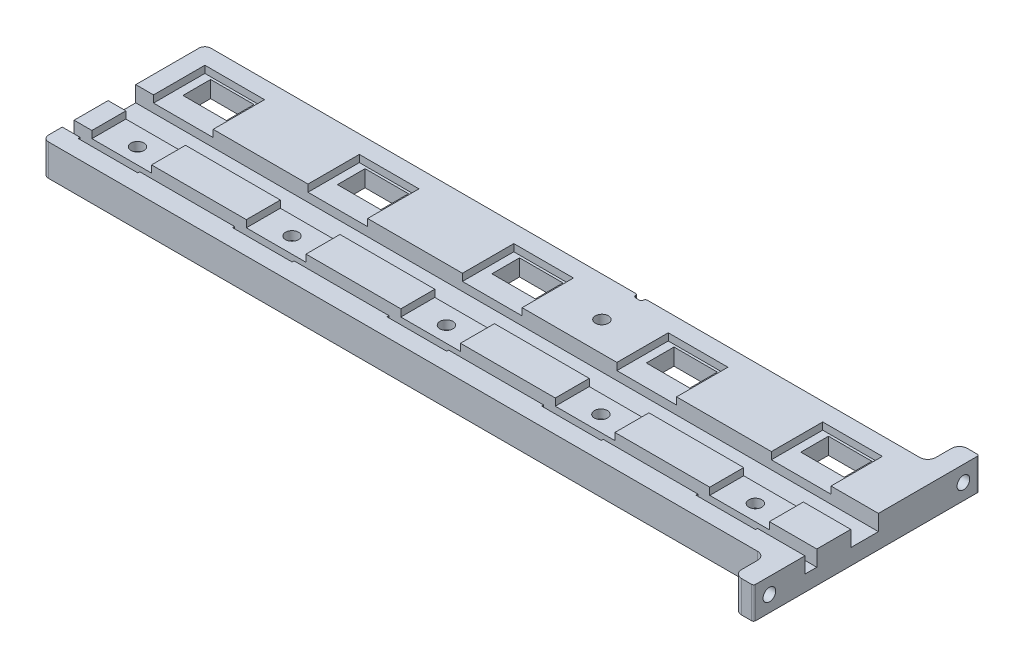
from build123d import *

# Parameters (mm, degrees)
SKETCH1_W           = 376
SKETCH1_H           = 41.1
SKETCH1_R           = 1.65
SKETCH1_W_2         = 11
SKETCH1_H_2         = 7
BOSS_EXTRUDE1_DEPTH = 8
SKETCH2_W           = 376
SKETCH2_H           = 3
SKETCH2_H_2         = 7
CUT_EXTRUDE1_DEPTH  = 4
CUT_EXTRUDE2_START  = -1.8
SKETCH3_W           = 15.1
SKETCH3_H           = 13
SKETCH3_W_2         = 11
SKETCH3_H_2         = 7
SKETCH3_H_3         = 8.6
SKETCH3_R           = 1.65
SKETCH3_H_4         = 0.5
CUT_EXTRUDE2_DEPTH  = 1.8
SKETCH5_R           = 1.65
CUT_EXTRUDE3_DEPTH  = 46.5
CHAMFER1_SIZE       = 2
CUT_EXTRUDE4_DEPTH  = 4
FILLET1_R           = 1.5
SKETCH7_W           = 188
SKETCH7_H           = 41.1
CUT_EXTRUDE5_DEPTH  = 70
SKETCH8_W           = 5
SKETCH8_H           = 8
BOSS_EXTRUDE2_DEPTH = 8
SKETCH9_R           = 1.6
CUT_EXTRUDE6_DEPTH  = 8
FILLET2_R           = 0.5
FILLET3_R           = 2
SKETCH11_W          = 2
SKETCH11_H          = 2
CUT_EXTRUDE7_DEPTH  = 13
FILLET4_R           = 0.5


with BuildPart() as part:
    # Sketch1 → Boss-Extrude1 (new body)
    with BuildSketch(Plane(origin=(0, 0, 0), x_dir=(1, 0, 0), z_dir=(0, 1, 0))):
        Rectangle(SKETCH1_W, SKETCH1_H)
        with Locations(Location((19.55, -8.55, 0), (0, 0, 270))):
            Circle(SKETCH1_R, mode=Mode.SUBTRACT)
        with Locations(Location((58.65, -8.55, 0), (0, 0, 270))):
            Circle(SKETCH1_R, mode=Mode.SUBTRACT)
        with Locations(Location((-19.55, -8.55, 0), (0, 0, 270))):
            Circle(SKETCH1_R, mode=Mode.SUBTRACT)
        with Locations(Location((97.75, -8.55, 0), (0, 0, 270))):
            Circle(SKETCH1_R, mode=Mode.SUBTRACT)
        with Locations(Location((-58.65, -8.55, 0), (0, 0, 270))):
            Circle(SKETCH1_R, mode=Mode.SUBTRACT)
        with Locations(Location((-97.75, -8.55, 0), (0, 0, 270))):
            Circle(SKETCH1_R, mode=Mode.SUBTRACT)
        with Locations(Location((-136.85, -8.55, 0), (0, 0, 270))):
            Circle(SKETCH1_R, mode=Mode.SUBTRACT)
        with Locations(Location((-175.95, -8.55, 0), (0, 0, 270))):
            Circle(SKETCH1_R, mode=Mode.SUBTRACT)
        with Locations(Location((136.85, -8.55, 0), (0, 0, 270))):
            Circle(SKETCH1_R, mode=Mode.SUBTRACT)
        with Locations(Location((175.95, -8.55, 0), (0, 0, 270))):
            Circle(SKETCH1_R, mode=Mode.SUBTRACT)
        with Locations((19.55, 11.95)):
            Rectangle(SKETCH1_W_2, SKETCH1_H_2, mode=Mode.SUBTRACT)
        with Locations((58.65, 11.95)):
            Rectangle(SKETCH1_W_2, SKETCH1_H_2, mode=Mode.SUBTRACT)
        with Locations((-19.55, 11.95)):
            Rectangle(SKETCH1_W_2, SKETCH1_H_2, mode=Mode.SUBTRACT)
        with Locations((97.75, 11.95)):
            Rectangle(SKETCH1_W_2, SKETCH1_H_2, mode=Mode.SUBTRACT)
        with Locations((-58.65, 11.95)):
            Rectangle(SKETCH1_W_2, SKETCH1_H_2, mode=Mode.SUBTRACT)
        with Locations((-97.75, 11.95)):
            Rectangle(SKETCH1_W_2, SKETCH1_H_2, mode=Mode.SUBTRACT)
        with Locations((-136.85, 11.95)):
            Rectangle(SKETCH1_W_2, SKETCH1_H_2, mode=Mode.SUBTRACT)
        with Locations((-175.95, 11.95)):
            Rectangle(SKETCH1_W_2, SKETCH1_H_2, mode=Mode.SUBTRACT)
        with Locations((136.85, 11.95)):
            Rectangle(SKETCH1_W_2, SKETCH1_H_2, mode=Mode.SUBTRACT)
        with Locations((175.95, 11.95)):
            Rectangle(SKETCH1_W_2, SKETCH1_H_2, mode=Mode.SUBTRACT)
    extrude(amount=BOSS_EXTRUDE1_DEPTH)

    # Sketch2 → Cut-Extrude1 (cut)
    with BuildSketch(Plane(origin=(0, 8, 0), x_dir=(1, 0, 0), z_dir=(0, 1, 0))):
        with Locations((0, -14.05)):
            Rectangle(SKETCH2_W, SKETCH2_H)
        with Locations((0, -0.45)):
            Rectangle(SKETCH2_W, SKETCH2_H_2)
    extrude(amount=-CUT_EXTRUDE1_DEPTH, mode=Mode.SUBTRACT)

    # Sketch3 → Cut-Extrude2 (cut)
    # profile 1 of 30: a face of its own
    with BuildSketch(Plane(origin=(0, 8, 0), x_dir=(1, 0, 0), z_dir=(0, 1, 0)).offset(CUT_EXTRUDE2_START)):
        with Locations((-175.95, 9.55)):
            Rectangle(SKETCH3_W, SKETCH3_H)
        with Locations((-175.95, 11.95)):
            Rectangle(SKETCH3_W_2, SKETCH3_H_2, mode=Mode.SUBTRACT)
    # profile 2 of 30: a face of its own
    with BuildSketch(Plane(origin=(0, 8, 0), x_dir=(1, 0, 0), z_dir=(0, 1, 0)).offset(CUT_EXTRUDE2_START)):
        with Locations((-175.95, -8.25)):
            Rectangle(SKETCH3_W, SKETCH3_H_3)
        with Locations(Location((-175.95, -8.55, 0), (0, 0, 90))):
            Circle(SKETCH3_R, mode=Mode.SUBTRACT)
    # profile 3 of 30: a face of its own
    with BuildSketch(Plane(origin=(0, 8, 0), x_dir=(1, 0, 0), z_dir=(0, 1, 0)).offset(CUT_EXTRUDE2_START)):
        with Locations((-136.85, 9.55)):
            Rectangle(SKETCH3_W, SKETCH3_H)
        with Locations((-136.85, 11.95)):
            Rectangle(SKETCH3_W_2, SKETCH3_H_2, mode=Mode.SUBTRACT)
    # profile 4 of 30: a face of its own
    with BuildSketch(Plane(origin=(0, 8, 0), x_dir=(1, 0, 0), z_dir=(0, 1, 0)).offset(CUT_EXTRUDE2_START)):
        with Locations((-175.95, -15.8)):
            Rectangle(SKETCH3_W, SKETCH3_H_4)
    # profile 5 of 30: a face of its own
    with BuildSketch(Plane(origin=(0, 8, 0), x_dir=(1, 0, 0), z_dir=(0, 1, 0)).offset(CUT_EXTRUDE2_START)):
        with Locations((-136.85, -8.25)):
            Rectangle(SKETCH3_W, SKETCH3_H_3)
        with Locations(Location((-136.85, -8.55, 0), (0, 0, 90))):
            Circle(SKETCH3_R, mode=Mode.SUBTRACT)
    # profile 6 of 30: a face of its own
    with BuildSketch(Plane(origin=(0, 8, 0), x_dir=(1, 0, 0), z_dir=(0, 1, 0)).offset(CUT_EXTRUDE2_START)):
        with Locations((-97.75, 9.55)):
            Rectangle(SKETCH3_W, SKETCH3_H)
        with Locations((-97.75, 11.95)):
            Rectangle(SKETCH3_W_2, SKETCH3_H_2, mode=Mode.SUBTRACT)
    # profile 7 of 30: a face of its own
    with BuildSketch(Plane(origin=(0, 8, 0), x_dir=(1, 0, 0), z_dir=(0, 1, 0)).offset(CUT_EXTRUDE2_START)):
        with Locations((-136.85, -15.8)):
            Rectangle(SKETCH3_W, SKETCH3_H_4)
    # profile 8 of 30: a face of its own
    with BuildSketch(Plane(origin=(0, 8, 0), x_dir=(1, 0, 0), z_dir=(0, 1, 0)).offset(CUT_EXTRUDE2_START)):
        with Locations((-97.75, -8.25)):
            Rectangle(SKETCH3_W, SKETCH3_H_3)
        with Locations(Location((-97.75, -8.55, 0), (0, 0, 90))):
            Circle(SKETCH3_R, mode=Mode.SUBTRACT)
    # profile 9 of 30: a face of its own
    with BuildSketch(Plane(origin=(0, 8, 0), x_dir=(1, 0, 0), z_dir=(0, 1, 0)).offset(CUT_EXTRUDE2_START)):
        with Locations((175.95, 9.55)):
            Rectangle(SKETCH3_W, SKETCH3_H)
        with Locations((175.95, 11.95)):
            Rectangle(SKETCH3_W_2, SKETCH3_H_2, mode=Mode.SUBTRACT)
    # profile 10 of 30: a face of its own
    with BuildSketch(Plane(origin=(0, 8, 0), x_dir=(1, 0, 0), z_dir=(0, 1, 0)).offset(CUT_EXTRUDE2_START)):
        with Locations((-58.65, 9.55)):
            Rectangle(SKETCH3_W, SKETCH3_H)
        with Locations((-58.65, 11.95)):
            Rectangle(SKETCH3_W_2, SKETCH3_H_2, mode=Mode.SUBTRACT)
    # profile 11 of 30: a face of its own
    with BuildSketch(Plane(origin=(0, 8, 0), x_dir=(1, 0, 0), z_dir=(0, 1, 0)).offset(CUT_EXTRUDE2_START)):
        with Locations((175.95, -8.25)):
            Rectangle(SKETCH3_W, SKETCH3_H_3)
        with Locations(Location((175.95, -8.55, 0), (0, 0, 90))):
            Circle(SKETCH3_R, mode=Mode.SUBTRACT)
    # profile 12 of 30: a face of its own
    with BuildSketch(Plane(origin=(0, 8, 0), x_dir=(1, 0, 0), z_dir=(0, 1, 0)).offset(CUT_EXTRUDE2_START)):
        with Locations((-97.75, -15.8)):
            Rectangle(SKETCH3_W, SKETCH3_H_4)
    # profile 13 of 30: a face of its own
    with BuildSketch(Plane(origin=(0, 8, 0), x_dir=(1, 0, 0), z_dir=(0, 1, 0)).offset(CUT_EXTRUDE2_START)):
        with Locations((-58.65, -8.25)):
            Rectangle(SKETCH3_W, SKETCH3_H_3)
        with Locations(Location((-58.65, -8.55, 0), (0, 0, 90))):
            Circle(SKETCH3_R, mode=Mode.SUBTRACT)
    # profile 14 of 30: a face of its own
    with BuildSketch(Plane(origin=(0, 8, 0), x_dir=(1, 0, 0), z_dir=(0, 1, 0)).offset(CUT_EXTRUDE2_START)):
        with Locations((136.85, 9.55)):
            Rectangle(SKETCH3_W, SKETCH3_H)
        with Locations((136.85, 11.95)):
            Rectangle(SKETCH3_W_2, SKETCH3_H_2, mode=Mode.SUBTRACT)
    # profile 15 of 30: a face of its own
    with BuildSketch(Plane(origin=(0, 8, 0), x_dir=(1, 0, 0), z_dir=(0, 1, 0)).offset(CUT_EXTRUDE2_START)):
        with Locations((-19.55, 9.55)):
            Rectangle(SKETCH3_W, SKETCH3_H)
        with Locations((-19.55, 11.95)):
            Rectangle(SKETCH3_W_2, SKETCH3_H_2, mode=Mode.SUBTRACT)
    # profile 16 of 30: a face of its own
    with BuildSketch(Plane(origin=(0, 8, 0), x_dir=(1, 0, 0), z_dir=(0, 1, 0)).offset(CUT_EXTRUDE2_START)):
        with Locations((175.95, -15.8)):
            Rectangle(SKETCH3_W, SKETCH3_H_4)
    # profile 17 of 30: a face of its own
    with BuildSketch(Plane(origin=(0, 8, 0), x_dir=(1, 0, 0), z_dir=(0, 1, 0)).offset(CUT_EXTRUDE2_START)):
        with Locations((136.85, -8.25)):
            Rectangle(SKETCH3_W, SKETCH3_H_3)
        with Locations(Location((136.85, -8.55, 0), (0, 0, 90))):
            Circle(SKETCH3_R, mode=Mode.SUBTRACT)
    # profile 18 of 30: a face of its own
    with BuildSketch(Plane(origin=(0, 8, 0), x_dir=(1, 0, 0), z_dir=(0, 1, 0)).offset(CUT_EXTRUDE2_START)):
        with Locations((-58.65, -15.8)):
            Rectangle(SKETCH3_W, SKETCH3_H_4)
    # profile 19 of 30: a face of its own
    with BuildSketch(Plane(origin=(0, 8, 0), x_dir=(1, 0, 0), z_dir=(0, 1, 0)).offset(CUT_EXTRUDE2_START)):
        with Locations((-19.55, -8.25)):
            Rectangle(SKETCH3_W, SKETCH3_H_3)
        with Locations(Location((-19.55, -8.55, 0), (0, 0, 90))):
            Circle(SKETCH3_R, mode=Mode.SUBTRACT)
    # profile 20 of 30: a face of its own
    with BuildSketch(Plane(origin=(0, 8, 0), x_dir=(1, 0, 0), z_dir=(0, 1, 0)).offset(CUT_EXTRUDE2_START)):
        with Locations((97.75, 9.55)):
            Rectangle(SKETCH3_W, SKETCH3_H)
        with Locations((97.75, 11.95)):
            Rectangle(SKETCH3_W_2, SKETCH3_H_2, mode=Mode.SUBTRACT)
    # profile 21 of 30: a face of its own
    with BuildSketch(Plane(origin=(0, 8, 0), x_dir=(1, 0, 0), z_dir=(0, 1, 0)).offset(CUT_EXTRUDE2_START)):
        with Locations((19.55, 9.55)):
            Rectangle(SKETCH3_W, SKETCH3_H)
        with Locations((19.55, 11.95)):
            Rectangle(SKETCH3_W_2, SKETCH3_H_2, mode=Mode.SUBTRACT)
    # profile 22 of 30: a face of its own
    with BuildSketch(Plane(origin=(0, 8, 0), x_dir=(1, 0, 0), z_dir=(0, 1, 0)).offset(CUT_EXTRUDE2_START)):
        with Locations((136.85, -15.8)):
            Rectangle(SKETCH3_W, SKETCH3_H_4)
    # profile 23 of 30: a face of its own
    with BuildSketch(Plane(origin=(0, 8, 0), x_dir=(1, 0, 0), z_dir=(0, 1, 0)).offset(CUT_EXTRUDE2_START)):
        with Locations((97.75, -8.25)):
            Rectangle(SKETCH3_W, SKETCH3_H_3)
        with Locations(Location((97.75, -8.55, 0), (0, 0, 90))):
            Circle(SKETCH3_R, mode=Mode.SUBTRACT)
    # profile 24 of 30: a face of its own
    with BuildSketch(Plane(origin=(0, 8, 0), x_dir=(1, 0, 0), z_dir=(0, 1, 0)).offset(CUT_EXTRUDE2_START)):
        with Locations((-19.55, -15.8)):
            Rectangle(SKETCH3_W, SKETCH3_H_4)
    # profile 25 of 30: a face of its own
    with BuildSketch(Plane(origin=(0, 8, 0), x_dir=(1, 0, 0), z_dir=(0, 1, 0)).offset(CUT_EXTRUDE2_START)):
        with Locations((19.55, -8.25)):
            Rectangle(SKETCH3_W, SKETCH3_H_3)
        with Locations(Location((19.55, -8.55, 0), (0, 0, 90))):
            Circle(SKETCH3_R, mode=Mode.SUBTRACT)
    # profile 26 of 30: a face of its own
    with BuildSketch(Plane(origin=(0, 8, 0), x_dir=(1, 0, 0), z_dir=(0, 1, 0)).offset(CUT_EXTRUDE2_START)):
        with Locations((58.65, 9.55)):
            Rectangle(SKETCH3_W, SKETCH3_H)
        with Locations((58.65, 11.95)):
            Rectangle(SKETCH3_W_2, SKETCH3_H_2, mode=Mode.SUBTRACT)
    # profile 27 of 30: a face of its own
    with BuildSketch(Plane(origin=(0, 8, 0), x_dir=(1, 0, 0), z_dir=(0, 1, 0)).offset(CUT_EXTRUDE2_START)):
        with Locations((97.75, -15.8)):
            Rectangle(SKETCH3_W, SKETCH3_H_4)
    # profile 28 of 30: a face of its own
    with BuildSketch(Plane(origin=(0, 8, 0), x_dir=(1, 0, 0), z_dir=(0, 1, 0)).offset(CUT_EXTRUDE2_START)):
        with Locations((58.65, -8.25)):
            Rectangle(SKETCH3_W, SKETCH3_H_3)
        with Locations(Location((58.65, -8.55, 0), (0, 0, 90))):
            Circle(SKETCH3_R, mode=Mode.SUBTRACT)
    # profile 29 of 30: a face of its own
    with BuildSketch(Plane(origin=(0, 8, 0), x_dir=(1, 0, 0), z_dir=(0, 1, 0)).offset(CUT_EXTRUDE2_START)):
        with Locations((19.55, -15.8)):
            Rectangle(SKETCH3_W, SKETCH3_H_4)
    # profile 30 of 30: a face of its own
    with BuildSketch(Plane(origin=(0, 8, 0), x_dir=(1, 0, 0), z_dir=(0, 1, 0)).offset(CUT_EXTRUDE2_START)):
        with Locations((58.65, -15.8)):
            Rectangle(SKETCH3_W, SKETCH3_H_4)
    extrude(amount=CUT_EXTRUDE2_DEPTH, mode=Mode.SUBTRACT)

    # Sketch5 → Cut-Extrude3 (cut)
    with BuildSketch(Plane(origin=(0, 8, 0), x_dir=(1, 0, 0), z_dir=(0, 1, 0))):
        with Locations(Location((-77.5, 10.55, 0), (0, 0, 270))):
            Circle(SKETCH5_R)
        with Locations(Location((77.5, 10.55, 0), (0, 0, 270))):
            Circle(SKETCH5_R)
    extrude(amount=-CUT_EXTRUDE3_DEPTH, mode=Mode.SUBTRACT)

    # Chamfer1
    chamfer1_edges = [part.edges().sort_by_distance(p)[0] for p in [
        (14.05, 0, -11.95),
        (19.55, 0, -15.45),
        (25.05, 0, -11.95),
        (19.55, 0, -8.45),
        (131.35, 0, -11.95),
        (136.85, 0, -8.45),
        (142.35, 0, -11.95),
        (136.85, 0, -15.45),
        (-142.35, 0, -11.95),
        (-136.85, 0, -8.45),
        (-131.35, 0, -11.95),
        (-136.85, 0, -15.45),
        (-64.15, 0, -11.95),
        (-58.65, 0, -8.45),
        (-53.15, 0, -11.95),
        (-58.65, 0, -15.45),
        (-25.05, 0, -11.95),
        (-19.55, 0, -8.45),
        (-14.05, 0, -11.95),
        (-19.55, 0, -15.45),
        (53.15, 0, -11.95),
        (58.65, 0, -8.45),
        (64.15, 0, -11.95),
        (58.65, 0, -15.45),
        (92.25, 0, -11.95),
        (97.75, 0, -8.45),
        (103.25, 0, -11.95),
        (97.75, 0, -15.45),
        (-103.25, 0, -11.95),
        (-97.75, 0, -8.45),
        (-92.25, 0, -11.95),
        (-97.75, 0, -15.45),
        (-181.45, 0, -11.95),
        (-175.95, 0, -8.45),
        (-170.45, 0, -11.95),
        (-175.95, 0, -15.45),
        (170.45, 0, -11.95),
        (175.95, 0, -8.45),
        (181.45, 0, -11.95),
        (175.95, 0, -15.45),
    ]]
    chamfer(chamfer1_edges, length=CHAMFER1_SIZE)

    # Sketch6 → Cut-Extrude4 (cut)
    with BuildSketch(Plane.XZ):
        Polygon((-136.85, 5.316838493), (-134.05, 6.933419246), (-134.05, 10.166580754), (-136.85, 11.783161507), (-139.65, 10.166580754), (-139.65, 6.933419246), align=None)
        Polygon((-175.95, 5.316838493), (-173.15, 6.933419246), (-173.15, 10.166580754), (-175.95, 11.783161507), (-178.75, 10.166580754), (-178.75, 6.933419246), align=None)
        Polygon((-97.75, 5.316838493), (-94.95, 6.933419246), (-94.95, 10.166580754), (-97.75, 11.783161507), (-100.55, 10.166580754), (-100.55, 6.933419246), align=None)
        Polygon((-58.65, 5.316838493), (-55.85, 6.933419246), (-55.85, 10.166580754), (-58.65, 11.783161507), (-61.45, 10.166580754), (-61.45, 6.933419246), align=None)
        Polygon((-19.55, 5.316838493), (-16.75, 6.933419246), (-16.75, 10.166580754), (-19.55, 11.783161507), (-22.35, 10.166580754), (-22.35, 6.933419246), align=None)
        Polygon((19.55, 5.316838493), (22.35, 6.933419246), (22.35, 10.166580754), (19.55, 11.783161507), (16.75, 10.166580754), (16.75, 6.933419246), align=None)
        Polygon((58.65, 5.316838493), (61.45, 6.933419246), (61.45, 10.166580754), (58.65, 11.783161507), (55.85, 10.166580754), (55.85, 6.933419246), align=None)
        Polygon((97.75, 5.316838493), (100.55, 6.933419246), (100.55, 10.166580754), (97.75, 11.783161507), (94.95, 10.166580754), (94.95, 6.933419246), align=None)
        Polygon((136.85, 5.316838493), (139.65, 6.933419246), (139.65, 10.166580754), (136.85, 11.783161507), (134.05, 10.166580754), (134.05, 6.933419246), align=None)
        Polygon((175.95, 5.316838493), (178.75, 6.933419246), (178.75, 10.166580754), (175.95, 11.783161507), (173.15, 10.166580754), (173.15, 6.933419246), align=None)
    extrude(amount=-CUT_EXTRUDE4_DEPTH, mode=Mode.SUBTRACT)

    # Fillet1
    fillet1_edges = [part.edges().sort_by_distance(p)[0] for p in [
        (188, 4, 20.55),
        (-188, 4, 20.55),
        (-188, 4, -20.55),
        (188, 4, -20.55),
    ]]
    fillet(fillet1_edges, radius=FILLET1_R)

    # Sketch7 → Cut-Extrude5 (cut)
    with BuildSketch(Plane(origin=(0, 8, 0), x_dir=(1, 0, 0), z_dir=(0, 1, 0))):
        with Locations((94, 0)):
            Rectangle(SKETCH7_W, SKETCH7_H)
    extrude(amount=-CUT_EXTRUDE5_DEPTH, mode=Mode.SUBTRACT)

    # Sketch8 → Boss-Extrude2 (add)
    with BuildSketch(Plane(origin=(0, 8, 0), x_dir=(1, 0, 0), z_dir=(0, 1, 0))):
        with Locations((-2.5, 24.55)):
            Rectangle(SKETCH8_W, SKETCH8_H)
        with Locations((-2.5, -24.55)):
            Rectangle(SKETCH8_W, SKETCH8_H)
    extrude(amount=-BOSS_EXTRUDE2_DEPTH)

    # Sketch9 → Cut-Extrude6 (cut)
    with BuildSketch(Plane.ZY.offset(5)):
        with Locations((-24.55, 4)):
            Circle(SKETCH9_R)
        with Locations((24.55, 4)):
            Circle(SKETCH9_R)
    extrude(amount=-CUT_EXTRUDE6_DEPTH, mode=Mode.SUBTRACT)

    # Fillet2
    fillet2_edges = [part.edges().sort_by_distance(p)[0] for p in [
        (0, 4, -28.55),
        (0, 4, 28.55),
    ]]
    fillet(fillet2_edges, radius=FILLET2_R)

    # Fillet3
    fillet3_edges = [part.edges().sort_by_distance(p)[0] for p in [
        (-5, 4, -20.55),
        (-5, 4, -28.55),
        (-5, 4, 28.55),
        (-5, 4, 20.55),
    ]]
    fillet(fillet3_edges, radius=FILLET3_R)

    # Sketch11 → Cut-Extrude7 (cut)
    with BuildSketch(Plane(origin=(0, 8, 0), x_dir=(1, 0, 0), z_dir=(0, 1, 0))):
        with Locations((-77.5, 20.55)):
            Rectangle(SKETCH11_W, SKETCH11_H)
    extrude(amount=-CUT_EXTRUDE7_DEPTH, mode=Mode.SUBTRACT)

    # Fillet4
    fillet4_edges = [part.edges().sort_by_distance(p)[0] for p in [
        (-78.5, 4, -19.55),
        (-76.5, 4, -19.55),
    ]]
    fillet(fillet4_edges, radius=FILLET4_R)
    fillet4_2_edges = [part.edges().sort_by_distance(p)[0] for p in [
        (-78.5, 4, -20.55),
        (-76.5, 4, -20.55),
    ]]
    fillet(fillet4_2_edges, radius=FILLET4_R - 0.0001)  # a hair under: the kernel refuses the full size


solid = part.part
